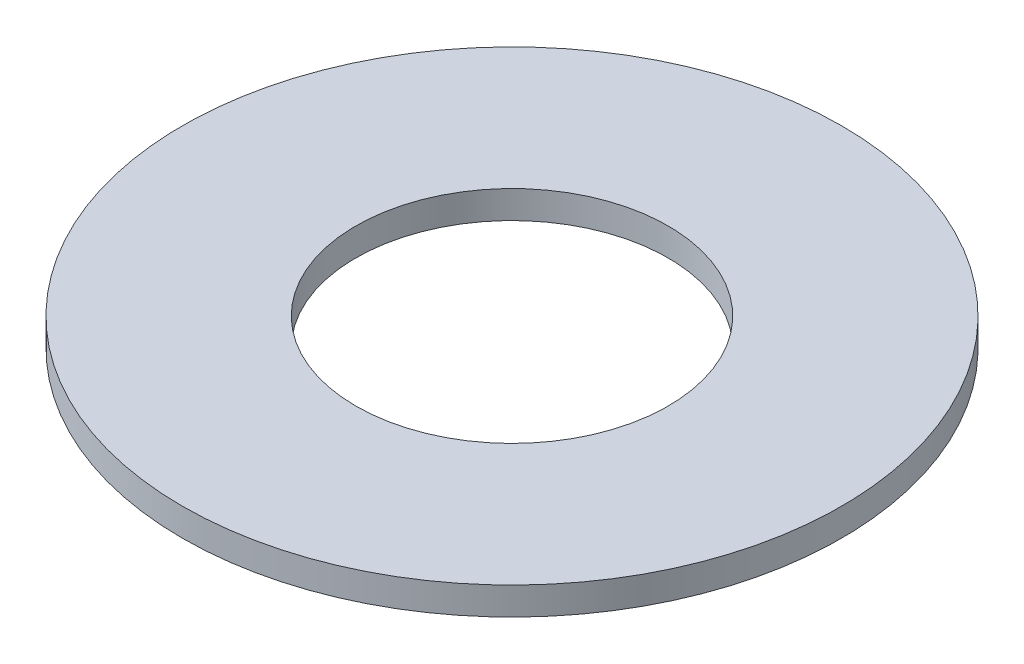
from build123d import *

# Parameters (mm, degrees)
SKETCH1_R           = 47.5
BOSS_EXTRUDE1_DEPTH = 4
SKETCH2_R           = 22.5
CUT_EXTRUDE1_DEPTH  = 68.294130502


with BuildPart() as part:
    # Sketch1 → Boss-Extrude1 (new body)
    with BuildSketch(Plane(origin=(0, 0, 0), x_dir=(1, 0, 0), z_dir=(0, 1, 0))):
        Circle(SKETCH1_R)
    extrude(amount=BOSS_EXTRUDE1_DEPTH)

    # Sketch2 → Cut-Extrude1 (cut, through all)
    with BuildSketch(Plane(origin=(0, 0, 0), x_dir=(1, 0, 0), z_dir=(0, 1, 0))):
        Circle(SKETCH2_R)
    extrude(amount=CUT_EXTRUDE1_DEPTH, mode=Mode.SUBTRACT)


solid = part.part
